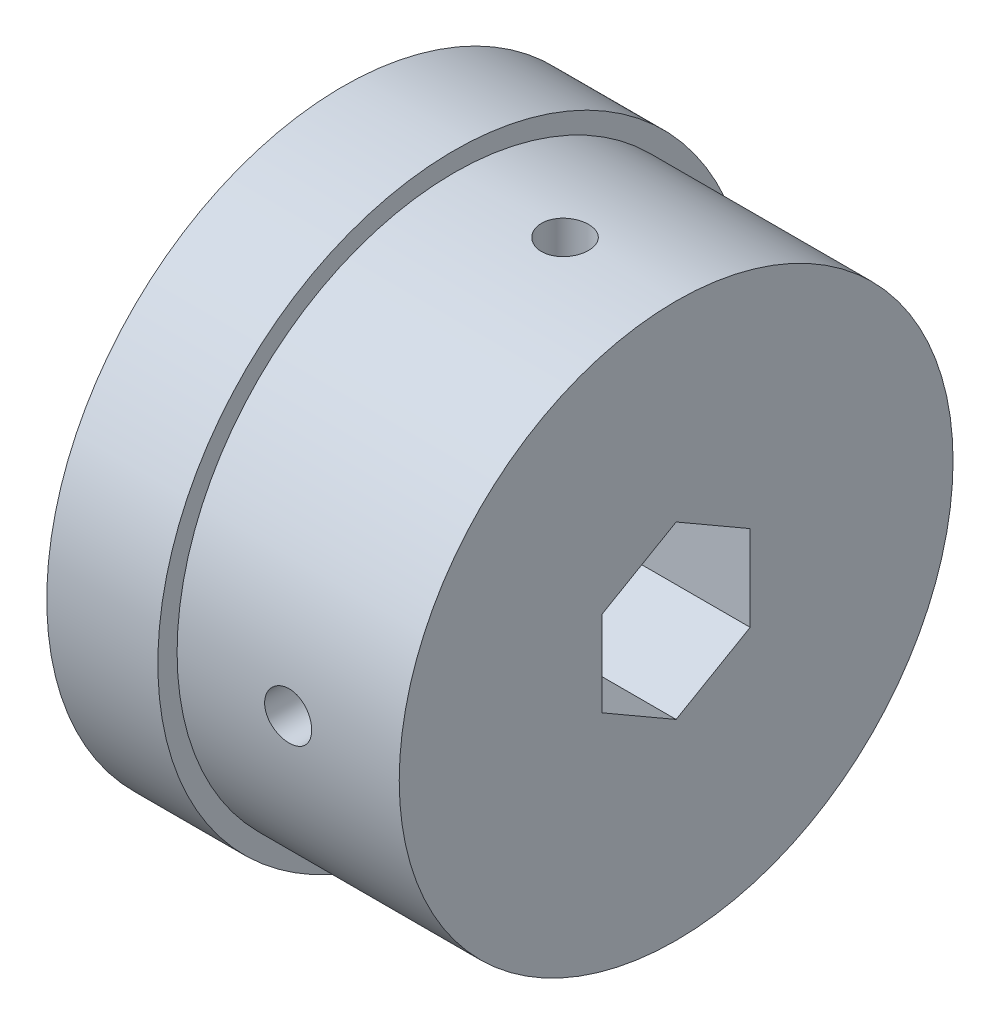
from build123d import *

# Parameters (mm, degrees)
SKETCH1_R               = 23.749
BOSS_EXTRUDE1_DEPTH     = 19.05
SKETCH2_R               = 25.4
BOSS_EXTRUDE2_DEPTH     = 9.525
CUT_EXTRUDE1_DEPTH      = 46.900442536
CUT_EXTRUDE3_DEPTH      = 41.659838908
CUT_EXTRUDE3_DEPTH_BACK = 41.659838908
SKETCH6_R               = 2.0193
CUT_EXTRUDE5_DEPTH      = 41.659838955
CUT_EXTRUDE5_DEPTH_BACK = 41.659838955
SKETCH12_R              = 2.0193


with BuildPart() as part:
    # Sketch1 → Boss-Extrude1 (new body)
    with BuildSketch(Plane(origin=(0, 0, 0), x_dir=(0, 0, -1), z_dir=(1, 0, 0))):
        Circle(SKETCH1_R)
    extrude(amount=BOSS_EXTRUDE1_DEPTH)

    # Sketch2 → Boss-Extrude2 (add)
    with BuildSketch(Plane.ZY):
        Circle(SKETCH2_R)
    extrude(amount=BOSS_EXTRUDE2_DEPTH)

    # Sketch4 → Cut-Extrude1 (cut, through all)
    with BuildSketch(Plane.ZY.offset(9.525)):
        Polygon((0, 7.332348419), (-6.35, 3.666174209), (-6.35, -3.666174209), (0, -7.332348419), (6.35, -3.666174209), (6.35, 3.666174209), align=None)
    extrude(amount=-CUT_EXTRUDE1_DEPTH, mode=Mode.SUBTRACT)

    # Sketch6 → Cut-Extrude3 (cut, two sides: drawn at the far end of the back side and taken through both)
    with BuildSketch(Plane.XY.offset(-CUT_EXTRUDE3_DEPTH_BACK)):
        with Locations((9.525, 0)):
            Circle(SKETCH6_R)
    extrude(amount=CUT_EXTRUDE3_DEPTH + CUT_EXTRUDE3_DEPTH_BACK, mode=Mode.SUBTRACT)

    # Sketch12 → Cut-Extrude5 (cut, two sides: drawn at the far end of the back side and taken through both)
    with BuildSketch(Plane(origin=(0, 0, 0), x_dir=(1, 0, 0), z_dir=(0, 1, 0)).offset(-CUT_EXTRUDE5_DEPTH_BACK)):
        with Locations((9.525, 0)):
            Circle(SKETCH12_R)
    extrude(amount=CUT_EXTRUDE5_DEPTH + CUT_EXTRUDE5_DEPTH_BACK, mode=Mode.SUBTRACT)


solid = part.part
